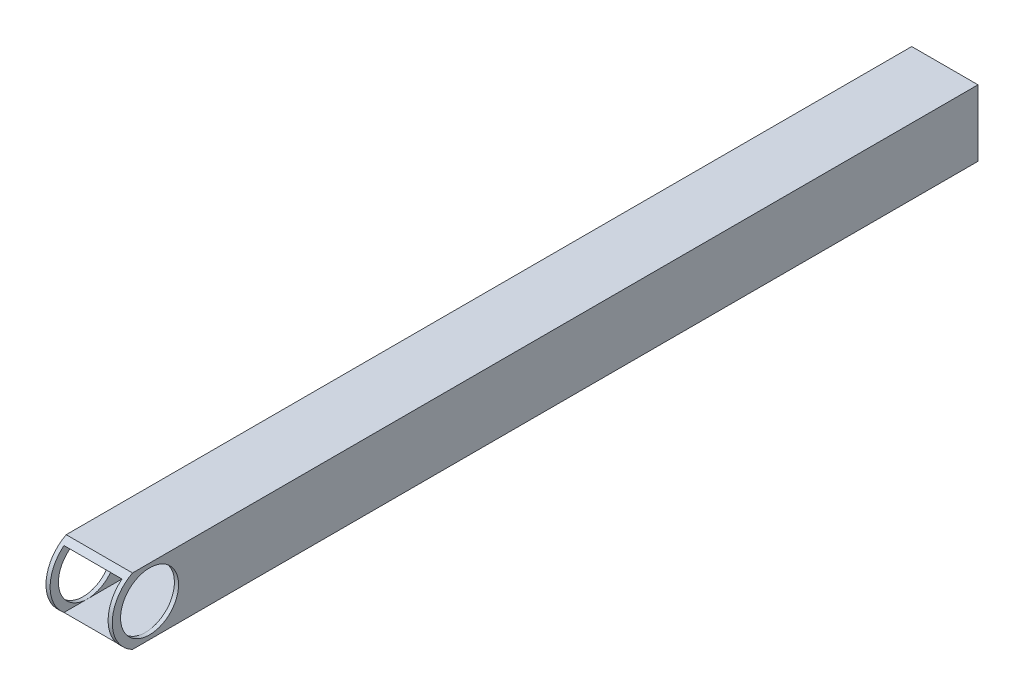
from build123d import *

# Parameters (mm, degrees)
SKETCH1_W                        = 25.4
SKETCH1_H                        = 25.4
SKETCH1_W_2                      = 22.225
SKETCH1_H_2                      = 22.225
EXTRUDE_THIN1_DEPTH              = 168.275
SKETCH2_R                        = 11.1125
CUT_EXTRUDE1_DEPTH               = 171.65440406
CUT_EXTRUDE2_DEPTH               = 171.65440406
F_1_8_0_135_DIAMETER_HOLE2_D     = 3.429
F_1_8_0_135_DIAMETER_HOLE2_DEPTH = 16.51
F_1_8_0_135_DIAMETER_HOLE2_TIP   = 1.030175531


with BuildPart() as part:
    # Sketch1 → Extrude-Thin1 (new, symmetric)
    with BuildSketch(Plane.XY):
        Rectangle(SKETCH1_W, SKETCH1_H)
        Rectangle(SKETCH1_W_2, SKETCH1_H_2, mode=Mode.SUBTRACT)
    extrude(amount=EXTRUDE_THIN1_DEPTH, both=True)

    # Sketch2 → Cut-Extrude1 (cut, through all)
    with BuildSketch(Plane(origin=(12.7, 0, 0), x_dir=(0, 0, -1), z_dir=(1, 0, 0))):
        with Locations((-149.225, 0)):
            Circle(SKETCH2_R)
    extrude(amount=-CUT_EXTRUDE1_DEPTH, mode=Mode.SUBTRACT)

    # Sketch3 → Cut-Extrude2 (cut, through all)
    with BuildSketch(Plane(origin=(12.7, 0, 0), x_dir=(0, 0, -1), z_dir=(1, 0, 0))):
        with BuildLine():
            Line((-149.225, 14.2875), (-168.275, 14.2875))
            Line((-168.275, 14.2875), (-168.275, -12.7))
            Line((-168.275, -12.7), (-155.770430181, -12.7))
            ThreePointArc((-155.770430181, -12.7), (-163.1099542, 3.367596045), (-149.225, 14.2875))
        make_face()
    extrude(amount=-CUT_EXTRUDE2_DEPTH, mode=Mode.SUBTRACT)

    # 1/8 (0.135) Diameter Hole2
    with Locations(Plane.ZY.offset(12.7)):
        with Locations((125.4125, -6.35), (100.0125, 6.35), (82.814583333, -6.35), (57.414583333, 6.35), (40.216666667, -6.35), (14.816666667, 6.35), (-2.38125, -6.35), (-27.78125, 6.35), (-44.979166667, -6.35), (-70.379166667, 6.35), (-87.577083333, -6.35), (-112.977083333, 6.35), (-130.175, -6.35), (-155.575, 6.35)):
            Hole(F_1_8_0_135_DIAMETER_HOLE2_D / 2, depth=F_1_8_0_135_DIAMETER_HOLE2_DEPTH)
            with Locations((0, 0, -(F_1_8_0_135_DIAMETER_HOLE2_DEPTH + F_1_8_0_135_DIAMETER_HOLE2_TIP / 2))):  # 118° drill point
                Cone(0, F_1_8_0_135_DIAMETER_HOLE2_D / 2, F_1_8_0_135_DIAMETER_HOLE2_TIP, mode=Mode.SUBTRACT)


solid = part.part
